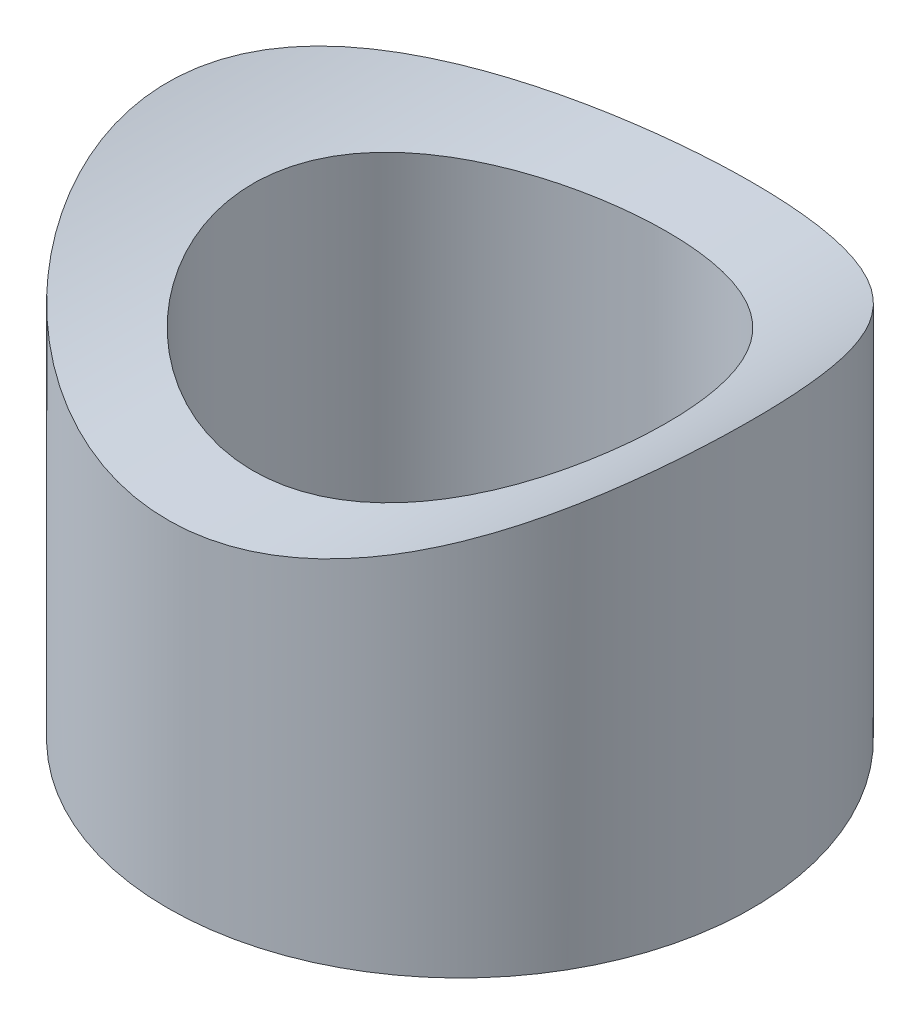
from build123d import *

# Parameters (mm, degrees)
SKETCH1_R               = 6
SKETCH1_R_2             = 4.25
BOSS_EXTRUDE1_DEPTH     = 6.9
SKETCH2_R               = 6
SKETCH2_R_2             = 4.25
BOSS_EXTRUDE2_DEPTH     = 4
CUT_EXTRUDE1_DEPTH      = 14.813399292
CUT_EXTRUDE1_DEPTH_BACK = 14.813399292
SKETCH3_R               = 11


with BuildPart() as part:
    # Sketch1 → Boss-Extrude1 (new body)
    with BuildSketch(Plane(origin=(0, 0, 0), x_dir=(1, 0, 0), z_dir=(0, 1, 0))):
        Circle(SKETCH1_R)
        Circle(SKETCH1_R_2, mode=Mode.SUBTRACT)
    extrude(amount=BOSS_EXTRUDE1_DEPTH)

    # Sketch2 → Boss-Extrude2 (add)
    with BuildSketch(Plane(origin=(0, 6.9, 0), x_dir=(1, 0, 0), z_dir=(0, 1, 0))):
        Circle(SKETCH2_R)
        Circle(SKETCH2_R_2, mode=Mode.SUBTRACT)
    extrude(amount=BOSS_EXTRUDE2_DEPTH)

    # Sketch3 → Cut-Extrude1 (cut, two sides: drawn at the far end of the back side and taken through both)
    with BuildSketch(Plane.XY.offset(-CUT_EXTRUDE1_DEPTH_BACK)):
        with Locations((0, 17.9)):
            Circle(SKETCH3_R)
    extrude(amount=CUT_EXTRUDE1_DEPTH + CUT_EXTRUDE1_DEPTH_BACK, mode=Mode.SUBTRACT)


solid = part.part
